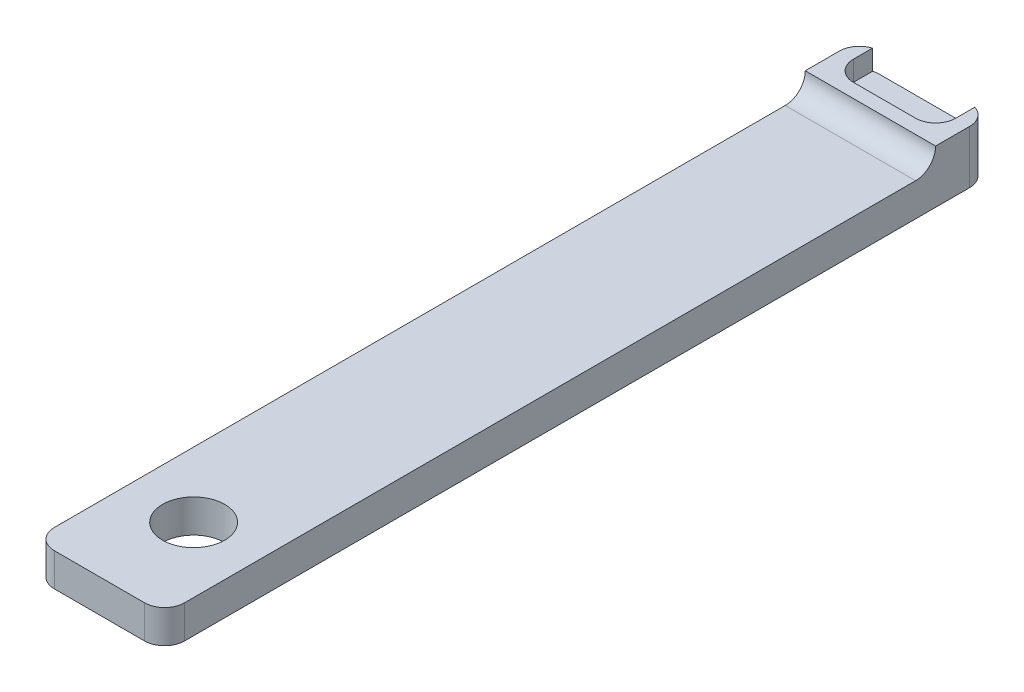
from build123d import *

# Parameters (mm, degrees)
SKETCH1_W           = 6.5
SKETCH1_H           = 41.15
SKETCH1_R           = 1.55
BOSS_EXTRUDE1_DEPTH = 1.65
BOSS_EXTRUDE2_DEPTH = 1
FILLET1_R           = 1


with BuildPart() as part:
    # Sketch1 → Boss-Extrude1 (new body)
    with BuildSketch(Plane(origin=(0, 0, 0), x_dir=(1, 0, 0), z_dir=(0, 1, 0))):
        with Locations((3.25, 20.575)):
            Rectangle(SKETCH1_W, SKETCH1_H)
        with Locations(Location((3.25, 4.7, 0), (0, 0, 270))):
            Circle(SKETCH1_R, mode=Mode.SUBTRACT)
    extrude(amount=BOSS_EXTRUDE1_DEPTH)

    # Sketch2 → Boss-Extrude2 (add)
    with BuildSketch(Plane(origin=(0, 1.65, 0), x_dir=(1, 0, 0), z_dir=(0, 1, 0))):
        Polygon((0, 41.15), (0.7, 41.15), (0.7, 39.15), (5.8, 39.15), (5.8, 41.15), (6.5, 41.15), (6.5, 39.15), (6.5, 38.45), (0, 38.45), (0, 39.15), align=None)
    extrude(amount=BOSS_EXTRUDE2_DEPTH)

    # Fillet1
    fillet1_edges = [part.edges().sort_by_distance(p)[0] for p in [
        (6.5, 1.325, -41.15),
        (0, 1.325, -41.15),
        (6.5, 0.825, 0),
        (0, 0.825, 0),
        (3.25, 1.65, -38.45),
        (0.7, 2.15, -39.15),
        (5.8, 2.15, -39.15),
    ]]
    fillet(fillet1_edges, radius=FILLET1_R - 0.0001)  # a hair under: the kernel refuses the full size


solid = part.part
